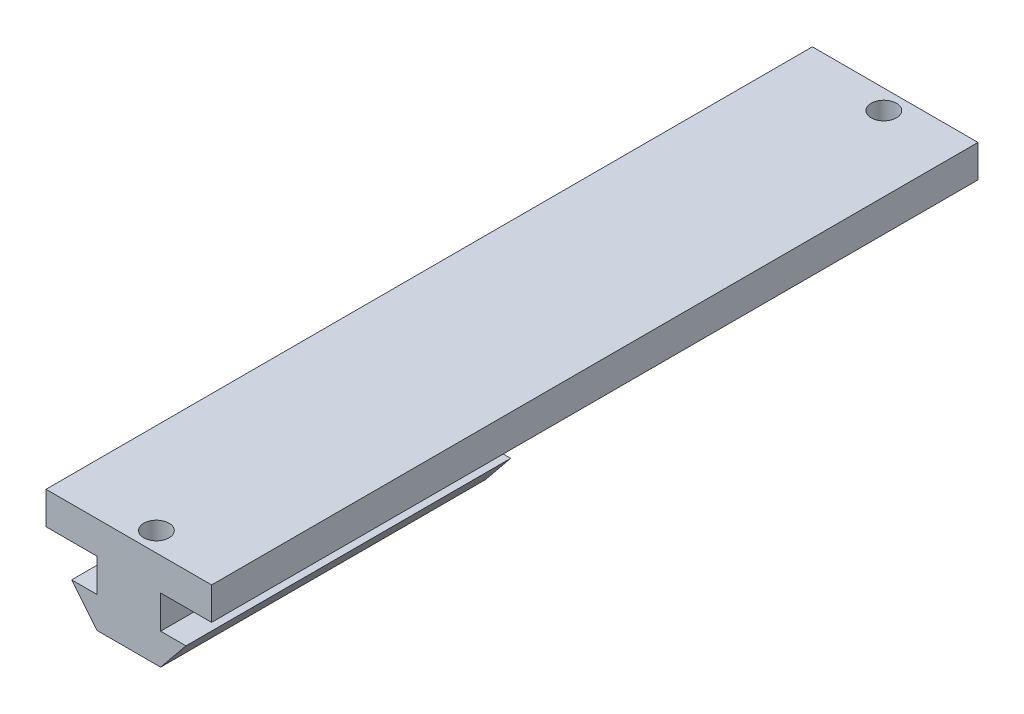
from build123d import *

# Parameters (mm, degrees)
SKETCH1_W           = 25.5
SKETCH1_H           = 118
BOSS_EXTRUDE1_DEPTH = 5
BOSS_EXTRUDE5_DEPTH = 50
SKETCH2_R           = 1.95
CUT_EXTRUDE1_DEPTH  = 10


with BuildPart() as part:
    # Sketch1 → Boss-Extrude1 (new body)
    with BuildSketch(Plane(origin=(0, 0, 0), x_dir=(1, 0, 0), z_dir=(0, 1, 0))):
        Rectangle(SKETCH1_W, SKETCH1_H)
    extrude(amount=BOSS_EXTRUDE1_DEPTH)

    # Sketch5 → Boss-Extrude5 (add)
    with BuildSketch(Plane.XY.offset(59)):
        Polygon((-4.9, 0), (-4.9, -5.1), (-8.8, -5.1), (-4.9, -9.9), (4.9, -9.9), (8.8, -5.1), (4.9, -5.1), (4.9, 0), align=None)
    extrude(amount=-BOSS_EXTRUDE5_DEPTH)

    # Sketch2 → Cut-Extrude1 (cut)
    with BuildSketch(Plane(origin=(0, 5, 0), x_dir=(1, 0, 0), z_dir=(0, 1, 0))):
        with Locations((1.25, 56)):
            Circle(SKETCH2_R)
        with Locations((1.25, -56)):
            Circle(SKETCH2_R)
    extrude(amount=-CUT_EXTRUDE1_DEPTH, mode=Mode.SUBTRACT)


solid = part.part
